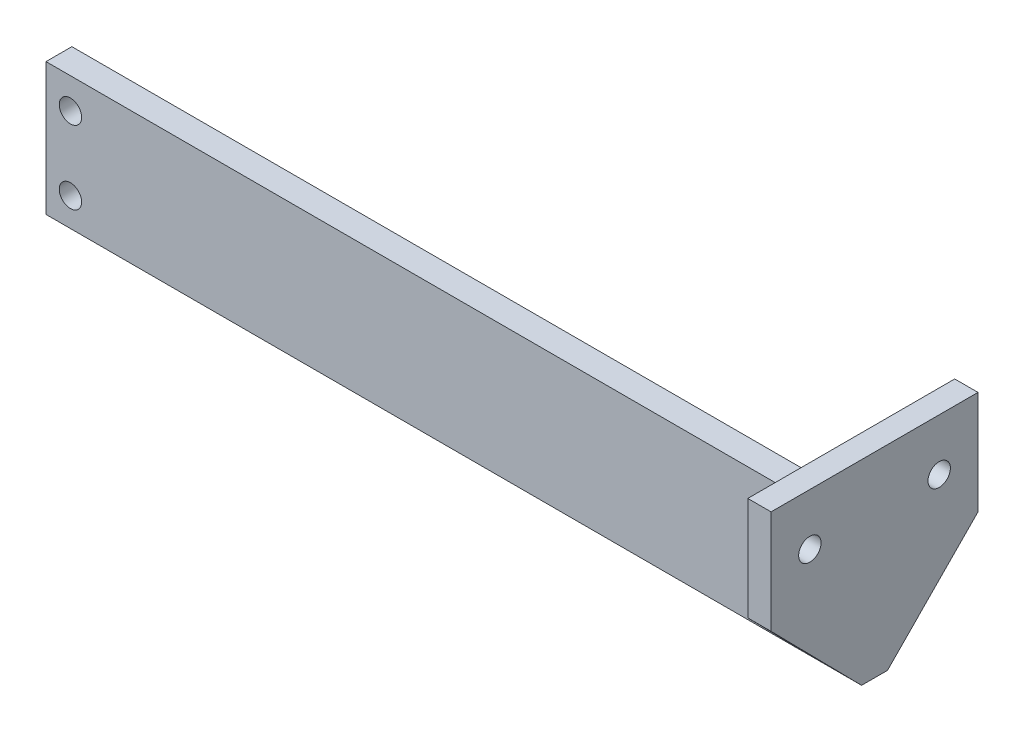
from build123d import *

# Parameters (mm, degrees)
SKETCH1_W           = 194.5
SKETCH1_H           = 32.5
BOSS_EXTRUDE1_DEPTH = 6.35
SKETCH2_R           = 2.75
CUT_EXTRUDE1_DEPTH  = 198.298815252
BOSS_EXTRUDE2_DEPTH = 5.715
SKETCH4_R           = 2.75
CUT_EXTRUDE2_DEPTH  = 208.860532295


with BuildPart() as part:
    # Sketch1 → Boss-Extrude1 (new body)
    with BuildSketch(Plane.XY):
        with Locations((97.25, 16.25)):
            Rectangle(SKETCH1_W, SKETCH1_H)
    extrude(amount=BOSS_EXTRUDE1_DEPTH)

    # Sketch2 → Cut-Extrude1 (cut, through all)
    with BuildSketch(Plane.XY.offset(6.35)):
        with Locations((6, 25)):
            Circle(SKETCH2_R)
        with Locations((6, 7)):
            Circle(SKETCH2_R)
    extrude(amount=-CUT_EXTRUDE1_DEPTH, mode=Mode.SUBTRACT)

    # Sketch3 → Boss-Extrude2 (add)
    with BuildSketch(Plane(origin=(194.5, 0, 0), x_dir=(0, 0, -1), z_dir=(1, 0, 0))):
        Polygon((-28.575, 22.594), (-6.35, 0), (0, 0), (22.225, 22.594), (22.225, 47.994), (-28.575, 47.994), align=None)
    extrude(amount=BOSS_EXTRUDE2_DEPTH)

    # Sketch4 → Cut-Extrude2 (cut, through all)
    with BuildSketch(Plane(origin=(200.215, 0, 0), x_dir=(0, 0, -1), z_dir=(1, 0, 0))):
        with Locations((-19.05, 35.294)):
            Circle(SKETCH4_R)
        with Locations((12.7, 35.294)):
            Circle(SKETCH4_R)
    extrude(amount=-CUT_EXTRUDE2_DEPTH, mode=Mode.SUBTRACT)


solid = part.part
